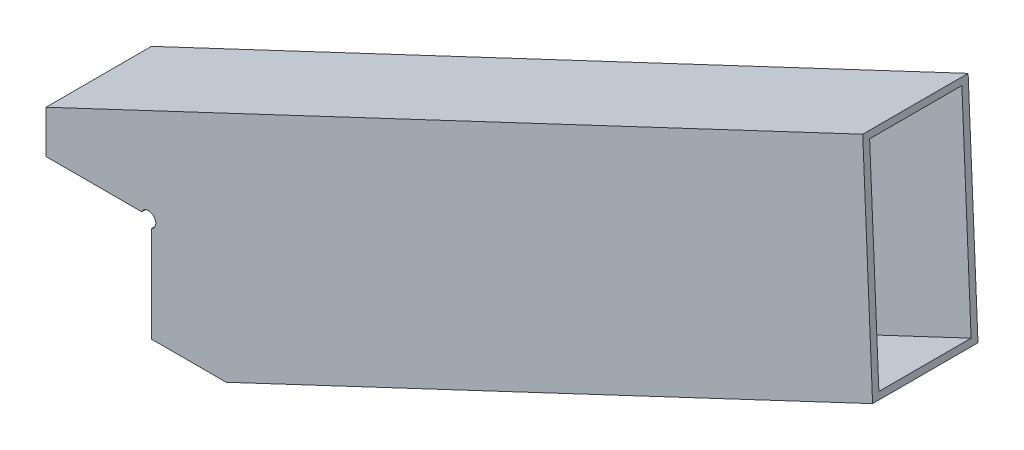
from build123d import *

# Parameters (mm, degrees)
BOSS_EXTRUDE1_DEPTH = 25.4
SHELL1_T            = -1.5875
SKETCH2_R           = 1.771315789
CUT_EXTRUDE1_DEPTH  = 223.011558967


with BuildPart() as part:
    # Sketch1 → Boss-Extrude1 (new body)
    with BuildSketch(Plane.XY):
        Polygon((174.584443495, 131.64058), (-22.225, 38.869539097), (-22.225, 28.575), (3.175, 28.575), (3.175, 3.175), (21.193373363, 3.175), (176.959684708, 76.599336681), align=None)
    extrude(amount=BOSS_EXTRUDE1_DEPTH)

    # Shell1
    shell1_openings = [part.faces().sort_by_distance(p)[0] for p in [
        (-9.525, 28.575, 12.7),
        (3.175, 15.875, 12.7),
        (175.772064102, 104.11995834, 12.7),
        (12.184186682, 3.175, 12.7),
        (-22.225, 33.722269548, 12.7),
    ]]
    offset(amount=SHELL1_T, openings=shell1_openings, kind=Kind.INTERSECTION)

    # Sketch2 → Cut-Extrude1 (cut, through all)
    with BuildSketch(Plane.XY.offset(25.4)):
        with Locations((2.461305961, 27.861305961)):
            Circle(SKETCH2_R)
    extrude(amount=-CUT_EXTRUDE1_DEPTH, mode=Mode.SUBTRACT)


solid = part.part
